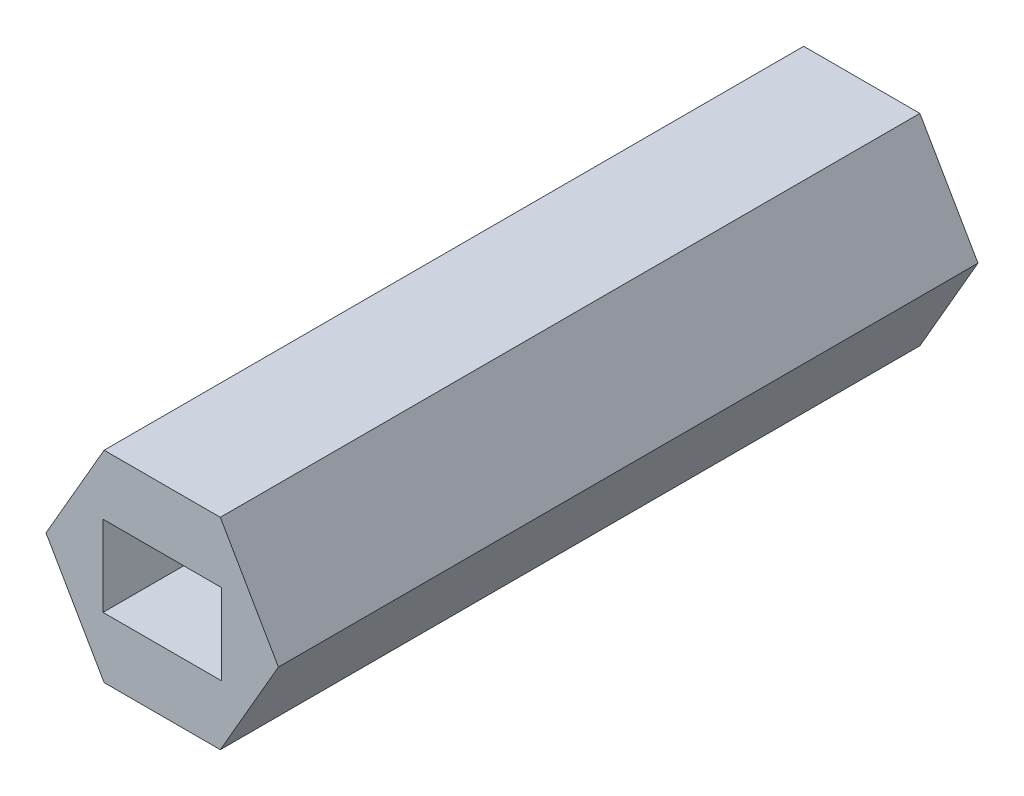
from build123d import *

# Parameters (mm, degrees)
SKETCH1_W           = 5.588
SKETCH1_H           = 3.81
BOSS_EXTRUDE1_DEPTH = 33.02


with BuildPart() as part:
    # Sketch1 → Boss-Extrude1 (new body)
    with BuildSketch(Plane.XY):
        Polygon((-2.742413779, 4.75), (-5.484827557, 0), (-2.742413779, -4.75), (2.742413779, -4.75), (5.484827557, 0), (2.742413779, 4.75), align=None)
        Rectangle(SKETCH1_W, SKETCH1_H, mode=Mode.SUBTRACT)
    extrude(amount=BOSS_EXTRUDE1_DEPTH)


solid = part.part
